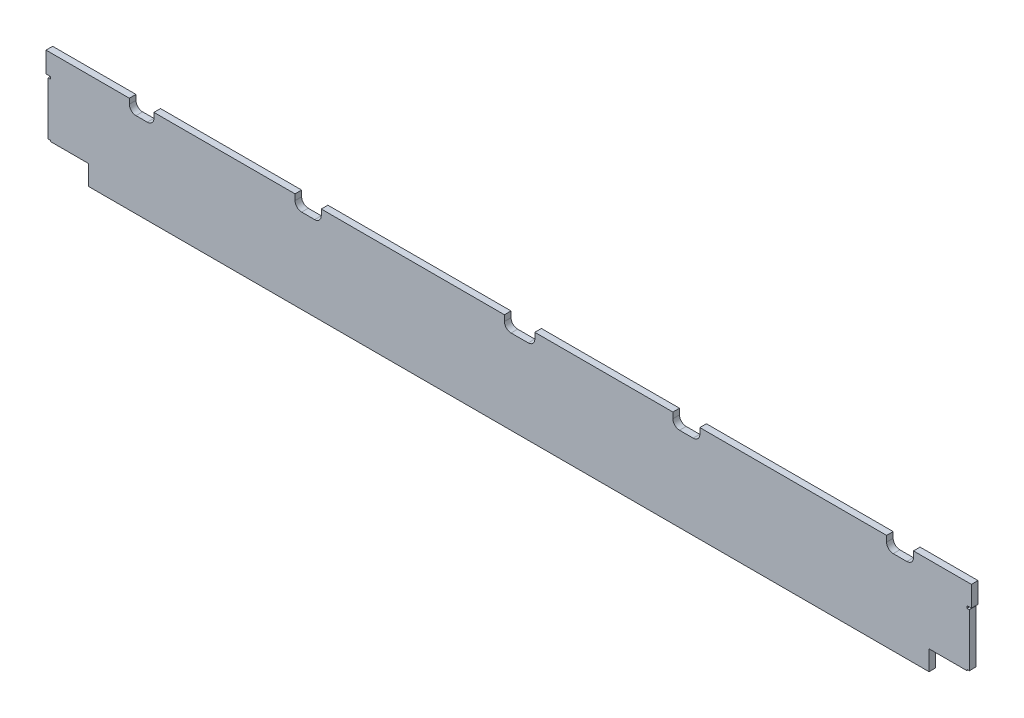
from build123d import *

# Parameters (mm, degrees)
BOSS_EXTRUDE1_DEPTH = 3.175


with BuildPart() as part:
    # Sketch2 → Boss-Extrude1 (new body)
    with BuildSketch(Plane.XY):
        with BuildLine():
            Line((-134.48222397, -157.216000107), (-174.499179878, -157.216000107))
            Line((-174.499179878, -157.216000107), (-174.499179878, -167.122000112))
            Line((-174.499179878, -167.122000112), (-172.356179878, -167.122000112))
            Line((-172.356179878, -167.122000112), (-172.356179878, -168.265000112))
            Line((-172.356179878, -168.265000112), (-173.499179878, -168.265000112))
            Line((-173.499179878, -168.265000112), (-173.499179878, -193.665000112))
            Line((-173.499179878, -193.665000112), (-172.356179878, -193.665000112))
            Line((-172.356179878, -193.665000112), (-172.356179878, -194.181000112))
            Line((-172.356179878, -194.181000112), (-154.179179878, -194.181000112))
            Line((-154.179179878, -194.181000112), (-154.179179878, -203.714000107))
            Line((-154.179179878, -203.714000107), (249.446820082, -203.714000107))
            Line((249.446820082, -203.714000107), (249.446820082, -194.181000112))
            Line((249.446820082, -194.181000112), (267.623820082, -194.181000112))
            Line((267.623820082, -194.181000112), (267.623820082, -193.665000112))
            Line((267.623820082, -193.665000112), (268.766820082, -193.665000112))
            Line((268.766820082, -193.665000112), (268.766820082, -168.265000112))
            Line((268.766820082, -168.265000112), (267.623820082, -168.265000112))
            Line((267.623820082, -168.265000112), (267.623820082, -167.122000112))
            Line((267.623820082, -167.122000112), (269.766820082, -167.122000112))
            Line((269.766820082, -167.122000112), (269.766820082, -157.216000107))
            Line((269.766820082, -157.216000107), (241.942931342, -157.216000107))
            Line((241.942931342, -157.216000112), (241.942931342, -160.028852641))
            ThreePointArc((241.942931342, -160.028852641), (241.012995373, -162.273916671), (238.767931342, -163.203852641))
            Line((238.767931342, -163.203852641), (232.228835622, -163.203852641))
            ThreePointArc((232.228835622, -163.203852641), (229.983771591, -162.273916671), (229.053835622, -160.028852641))
            Line((229.053835622, -160.028852641), (229.053835622, -157.216000111))
            Line((229.053835622, -157.216000107), (139.391671268, -157.216000107))
            Line((139.391671268, -157.216000111), (139.391671268, -160.028852641))
            ThreePointArc((139.391671268, -160.028852641), (138.461735298, -162.273916672), (136.216671268, -163.203852641))
            Line((136.216671268, -163.203852641), (129.634287037, -163.203852641))
            ThreePointArc((129.634287037, -163.203852641), (127.389223006, -162.273916672), (126.459287037, -160.028852641))
            Line((126.459287037, -160.028852641), (126.459287037, -157.216000111))
            Line((126.459287037, -157.216000107), (60.173906138, -157.216000107))
            Line((60.173906138, -157.216000111), (60.173906138, -160.028852641))
            ThreePointArc((60.173906138, -160.028852641), (59.243970168, -162.273916672), (56.998906138, -163.203852641))
            Line((56.998906138, -163.203852641), (48.759688995, -163.203852641))
            ThreePointArc((48.759688995, -163.203852641), (46.514624964, -162.273916672), (45.584688995, -160.028852641))
            Line((45.584688995, -160.028852641), (45.584688995, -157.216000112))
            Line((45.584688995, -157.216000107), (-42.350318447, -157.216000107))
            Line((-42.350318447, -157.216000112), (-42.350318447, -160.028852641))
            ThreePointArc((-42.350318447, -160.028852641), (-43.280254417, -162.273916672), (-45.525318447, -163.203852641))
            Line((-45.525318447, -163.203852641), (-51.766012694, -163.203852641))
            ThreePointArc((-51.766012694, -163.203852641), (-54.011076724, -162.273916672), (-54.941012694, -160.028852641))
            Line((-54.941012694, -160.028852641), (-54.941012694, -157.216000112))
            Line((-54.941012694, -157.216000107), (-122.690938882, -157.216000107))
            Line((-122.690938882, -157.216000112), (-122.690938882, -159.695723948))
            ThreePointArc((-122.690938882, -159.695723948), (-123.620874852, -161.940787978), (-125.865938882, -162.870723948))
            Line((-125.865938882, -162.870723948), (-131.30722397, -162.870723948))
            ThreePointArc((-131.30722397, -162.870723948), (-133.552288001, -161.940787978), (-134.48222397, -159.695723948))
            Line((-134.48222397, -159.695723948), (-134.48222397, -157.216000107))
        make_face()
    extrude(amount=BOSS_EXTRUDE1_DEPTH)


solid = part.part
